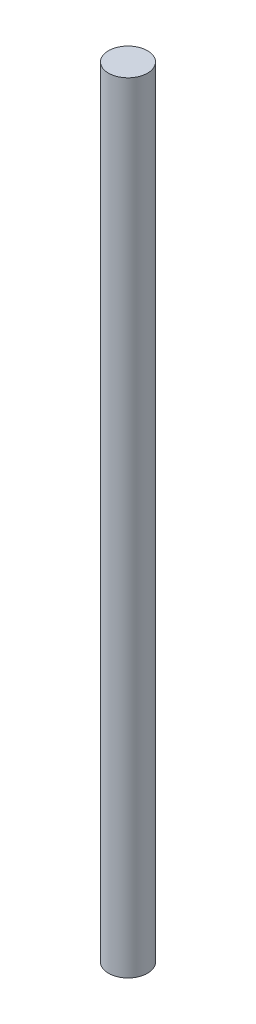
from build123d import *

# Parameters (mm, degrees)
SKETCH1_R           = 2.5
BOSS_EXTRUDE1_DEPTH = 100


with BuildPart() as part:
    # Sketch1 → Boss-Extrude1 (new body)
    with BuildSketch(Plane(origin=(0, 0, 0), x_dir=(1, 0, 0), z_dir=(0, 1, 0))):
        Circle(SKETCH1_R)
    extrude(amount=BOSS_EXTRUDE1_DEPTH)


solid = part.part
